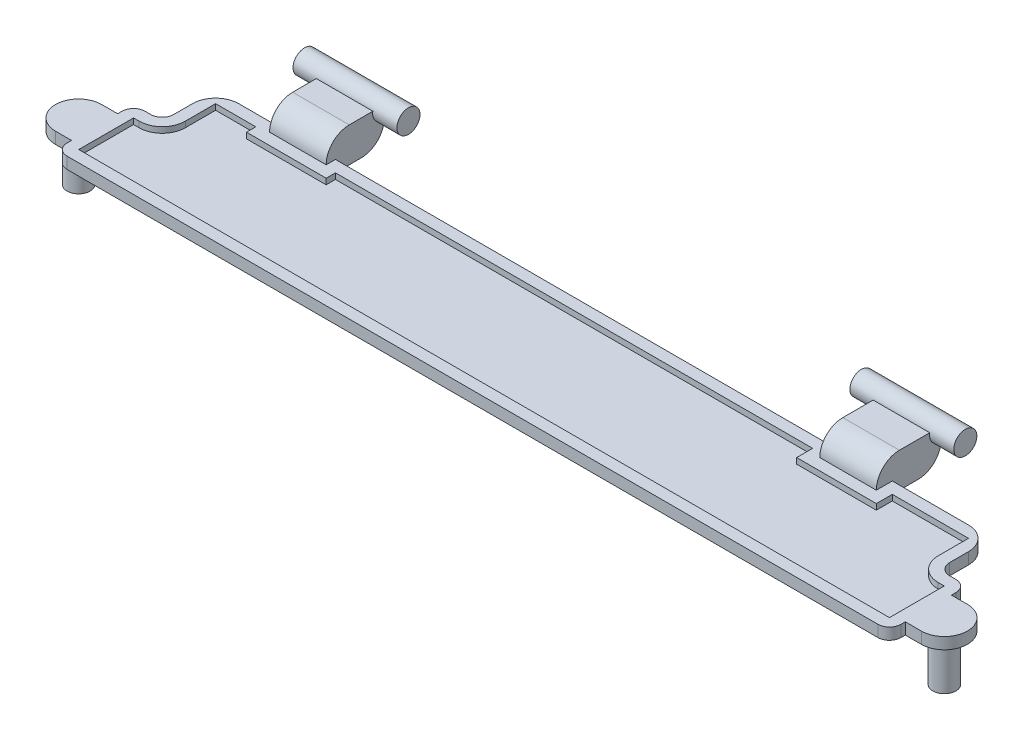
from build123d import *

# Parameters (mm, degrees)
SKETCH1_R                = 2
BOSS_EXTRUDE1_DEPTH      = 2.5
BOSS_EXTRUDE1_2_DEPTH    = 2.5
BOSS_EXTRUDE3_DEPTH      = 1
FILLET1_R                = 1
BOSS_EXTRUDE4_DEPTH      = 2
BOSS_EXTRUDE4_DEPTH_BACK = 1
SKETCH3_W                = 4.9
SKETCH3_H                = 5.030022666
SKETCH3_H_2              = 5.609354891
BOSS_EXTRUDE5_DEPTH      = 2
BOSS_EXTRUDE5_DEPTH_BACK = 7
SKETCH4_R                = 1
BOSS_EXTRUDE6_DEPTH      = 2
BOSS_EXTRUDE6_DEPTH_BACK = 7
SKETCH5_R                = 1
FILLET2_R                = 2
FILLET3_R                = 2
CUT_EXTRUDE1_DEPTH       = 0.5
FILLET4_R                = 2
FILLET6_R                = 2
SKETCH7_W                = 77.047719234
SKETCH7_H                = 13.468868212
CUT_EXTRUDE2_DEPTH       = 10
SKETCH8_R                = 1
BOSS_EXTRUDE7_DEPTH      = 4
BOSS_EXTRUDE7_2_DEPTH    = 4
BOSS_EXTRUDE8_DEPTH      = 1
SKETCH10_W               = 70.230539596
SKETCH10_H               = 4.186533739
CUT_EXTRUDE4_DEPTH       = 1


# Some blends are built 0.0001 mm under size
with BuildPart() as part:
    # Sketch1 → Boss-Extrude1 (new body)
    with BuildSketch(Plane(origin=(0, 0, 0), x_dir=(1, 0, 0), z_dir=(0, 1, 0))):
        with Locations(Location((67.22, 0, 0), (0, 0, 270))):
            Circle(SKETCH1_R)
    extrude(amount=BOSS_EXTRUDE1_DEPTH)



with BuildPart() as body_2:
    # Sketch1 → Boss-Extrude1 2 (new body)
    with BuildSketch(Plane(origin=(0, 0, 0), x_dir=(1, 0, 0), z_dir=(0, 1, 0))):
        with Locations(Location((0, 0, 0), (0, 0, 270))):
            Circle(SKETCH1_R)
    extrude(amount=BOSS_EXTRUDE1_2_DEPTH)


with BuildPart() as part_1:
    add(part.part)

    add(body_2.part)  # Boss-Extrude3 merges body 2
    # Sketch2 → Boss-Extrude3 (add)
    with BuildSketch(Plane(origin=(0, 2.5, 0), x_dir=(1, 0, 0), z_dir=(0, 1, 0))):
        Polygon((0, 3.373067478), (0, 8), (67.22031246, 8), (67.22031246, 3.373067478), (69.745167769, 3.373067478), (69.745167769, -3.373067478), (-2.485371827, -3.373067478), (-2.485371827, 3.373067478), align=None)
    extrude(amount=BOSS_EXTRUDE3_DEPTH)

    # Fillet1
    fillet1_edges = [part_1.edges().sort_by_distance(p)[0] for p in [
        (67.22031246, 3, -3.373067478),
        (0, 3, -3.373067478),
        (-2.485371827, 3, -3.373067478),
        (-2.485371827, 3, 3.373067478),
        (69.745167769, 3, 3.373067478),
        (69.745167769, 3, -3.373067478),
    ]]
    fillet(fillet1_edges, radius=FILLET1_R)

    # Sketch3 → Boss-Extrude4 (add, two sides: drawn at the far end of the back side and taken through both)
    with BuildSketch(Plane(origin=(0, 3.5, 0), x_dir=(1, 0, 0), z_dir=(0, 1, 0)).offset(-BOSS_EXTRUDE4_DEPTH_BACK)):
        with Locations((7.93, 9.710321272)):
            Rectangle(SKETCH3_W, SKETCH3_H)
        with Locations((56.17, 9.42065516)):
            Rectangle(SKETCH3_W, SKETCH3_H_2)
    extrude(amount=BOSS_EXTRUDE4_DEPTH + BOSS_EXTRUDE4_DEPTH_BACK)

    # Sketch4 → Boss-Extrude5 (add, two sides: drawn at the far end of the back side and taken through both)
    with BuildSketch(Plane.ZY.offset(-5.48).offset(-BOSS_EXTRUDE5_DEPTH_BACK)):
        with Locations((-12.225332605, 5.316497078)):
            Circle(SKETCH4_R)
    extrude(amount=BOSS_EXTRUDE5_DEPTH + BOSS_EXTRUDE5_DEPTH_BACK)

    # Sketch5 → Boss-Extrude6 (add, two sides: drawn at the far end of the back side and taken through both)
    with BuildSketch(Plane.ZY.offset(-53.72).offset(-BOSS_EXTRUDE6_DEPTH_BACK)):
        with Locations((-12.225332605, 5.316497078)):
            Circle(SKETCH5_R)
    extrude(amount=BOSS_EXTRUDE6_DEPTH + BOSS_EXTRUDE6_DEPTH_BACK)

    # Fillet2
    fillet2_edges = [part_1.edges().sort_by_distance(p)[0] for p in [
        (7.93, 5.5, -7.195309939),
        (56.17, 5.5, -6.615977714),
    ]]
    fillet(fillet2_edges, radius=FILLET2_R - 0.0001)  # a hair under: the kernel refuses the full size

    # Fillet3
    # the kernel refuses this fillet: 2 mm, written as the material it takes off along each edge
    with BuildSketch(Plane(origin=(48.741090307, 2.5, -12.225332605), x_dir=(0, 0, 1), z_dir=(1, 0, 0))) as fillet3_piece_1:
        with BuildLine():
            CenterArc((1.991563877, -2), FILLET3_R, 90, 84.735624625)
            Line((0, -1.816497078), (-0.039831278, -1.81282702))
            ThreePointArc((-0.039831278, -1.81282702), (-0.04, -0.908248539), (-0.04, 0))
            Line((-0.04, 0), (0, 0.04))
            Line((0, 0.04), (1.991563877, 0.04))
            Line((1.991563877, 0.04), (1.991563877, 0))
        make_face()
    extrude(amount=14.857819387, mode=Mode.SUBTRACT)

    # Sketch6 → Cut-Extrude1 (cut)
    with BuildSketch(Plane(origin=(0, 3.5, 0), x_dir=(1, 0, 0), z_dir=(0, 1, 0))):
        with BuildLine():
            Line((59.62, 5.615977714), (52.72, 5.615977714))
            Line((52.72, 5.615977714), (52.72, 7))
            Line((52.72, 7), (11.38, 7))
            Line((11.38, 7), (11.38, 6.195309939))
            Line((11.38, 6.195309939), (4.48, 6.195309939))
            Line((4.48, 6.195309939), (4.48, 7))
            Line((4.48, 7), (1, 7))
            Line((1, 7), (1, 4.373067478))
            ThreePointArc((1, 4.373067478), (0.414213562, 2.958853916), (-1, 2.373067478))
            Line((-1, 2.373067478), (-1.485371827, 2.373067478))
            Line((-1.485371827, 2.373067478), (-1.485371827, -2.373067478))
            Line((-1.485371827, -2.373067478), (68.745167769, -2.373067478))
            Line((68.745167769, -2.373067478), (68.745167769, 2.373067478))
            Line((68.745167769, 2.373067478), (68.22031246, 2.373067478))
            ThreePointArc((68.22031246, 2.373067478), (66.806098898, 2.958853916), (66.22031246, 4.373067478))
            Line((66.22031246, 4.373067478), (66.22031246, 7))
            Line((66.22031246, 7), (59.62, 7))
            Line((59.62, 7), (59.62, 5.615977714))
        make_face()
    extrude(amount=-CUT_EXTRUDE1_DEPTH, mode=Mode.SUBTRACT)

    # Fillet4
    # the kernel refuses this fillet: 2 mm, written as the material it takes off along each edge
    with BuildSketch(Plane(origin=(15.358909693, 2.5, -12.225332605), x_dir=(0, 0, 1), z_dir=(-1, 0, 0))) as fillet4_piece_1:
        with BuildLine():
            CenterArc((1.991563877, 2), FILLET4_R, 185.264375375, 84.735624625)
            Line((0, 1.816497078), (-0.039831278, 1.81282702))
            ThreePointArc((-0.039831278, 1.81282702), (-0.04, 0.908248539), (-0.04, 0))
            Line((-0.04, 0), (0, -0.04))
            Line((0, -0.04), (1.991563877, -0.04))
            Line((1.991563877, -0.04), (1.991563877, 0))
        make_face()
    extrude(amount=14.857819387, mode=Mode.SUBTRACT)

    # Fillet6
    fillet6_edges = [part_1.edges().sort_by_distance(p)[0] for p in [
        (67.22031246, 3, -8),
        (0, 3, -8),
    ]]
    fillet(fillet6_edges, radius=FILLET6_R)

    # Sketch7 → Cut-Extrude2 (cut)
    with BuildSketch(Plane.XZ.offset(-2.5)):
        with Locations((32.181632572, 2.423814337)):
            Rectangle(SKETCH7_W, SKETCH7_H)
    extrude(amount=CUT_EXTRUDE2_DEPTH, mode=Mode.SUBTRACT)



with BuildPart() as body_2_2:
    # Sketch8 → Boss-Extrude7 (new body)
    with BuildSketch(Plane(origin=(0, 2.5, 0), x_dir=(-1, 0, 0), z_dir=(0, -1, 0))):
        with Locations(Location((3.870102029, 0, 0), (0, 0, 90))):
            Circle(SKETCH8_R)
    extrude(amount=BOSS_EXTRUDE7_DEPTH)


with BuildPart() as body_3:
    # Sketch8 → Boss-Extrude7 2 (new body)
    with BuildSketch(Plane(origin=(0, 2.5, 0), x_dir=(-1, 0, 0), z_dir=(0, -1, 0))):
        with Locations(Location((-71.129897971, 0, 0), (0, 0, 90))):
            Circle(SKETCH8_R)
    extrude(amount=BOSS_EXTRUDE7_2_DEPTH)


with BuildPart() as part_2:
    add(part_1.part)

    add(body_2_2.part)  # Boss-Extrude8 merges body 2 2

    add(body_3.part)  # Boss-Extrude8 merges body 3
    # Sketch9 → Boss-Extrude8 (add)
    with BuildSketch(Plane.XZ.offset(-2.5)):
        with BuildLine():
            Line((-3.870102029, 2), (71.129897971, 2))
            ThreePointArc((71.129897971, 2), (73.129897971, 0), (71.129897971, -2))
            Line((71.129897971, -2), (-3.870102029, -2))
            ThreePointArc((-3.870102029, -2), (-5.870102029, 0), (-3.870102029, 2))
        make_face()
    extrude(amount=-BOSS_EXTRUDE8_DEPTH)

    # Sketch10 → Cut-Extrude4 (cut)
    with BuildSketch(Plane(origin=(0, 3, 0), x_dir=(1, 0, 0), z_dir=(0, 1, 0))):
        with Locations((33.629897971, -0.09326687)):
            Rectangle(SKETCH10_W, SKETCH10_H)
    extrude(amount=CUT_EXTRUDE4_DEPTH, mode=Mode.SUBTRACT)


solid = part_2.part
